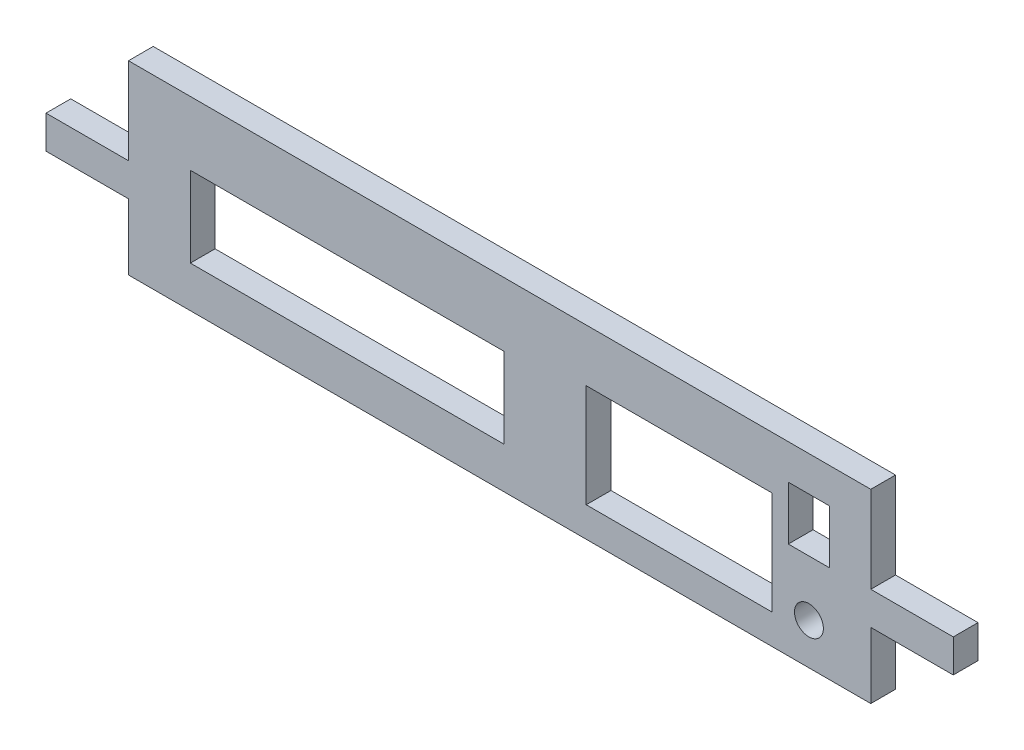
from build123d import *

# Parameters (mm, degrees)
ESBO_O1_W                = 76
ESBO_O1_H                = 19.5
ESBO_O1_R                = 3.5
ESBO_O1_W_2              = 45
ESBO_O1_H_2              = 25
ESBO_O1_W_3              = 10
ESBO_O1_H_3              = 13
RESSALTO_EXTRUS_O1_DEPTH = 6


with BuildPart() as part:
    # Esboço1 → Ressalto-extrusão1 (new body)
    with BuildSketch(Plane.XY):
        Polygon((-110, -6.5), (-90, -6.5), (-90, -22.5), (90, -22.5), (90, -6.5), (110, -6.5), (110, 1.5), (90, 1.5), (90, 22.5), (-90, 22.5), (-90, 1.5), (-110, 1.5), align=None)
        with Locations((-37, -2.75)):
            Rectangle(ESBO_O1_W, ESBO_O1_H, mode=Mode.SUBTRACT)
        with Locations((75, -12.5)):
            Circle(ESBO_O1_R, mode=Mode.SUBTRACT)
        with Locations((43.5, -2.75)):
            Rectangle(ESBO_O1_W_2, ESBO_O1_H_2, mode=Mode.SUBTRACT)
        with Locations((75, 7.5)):
            Rectangle(ESBO_O1_W_3, ESBO_O1_H_3, mode=Mode.SUBTRACT)
    extrude(amount=RESSALTO_EXTRUS_O1_DEPTH)


solid = part.part
